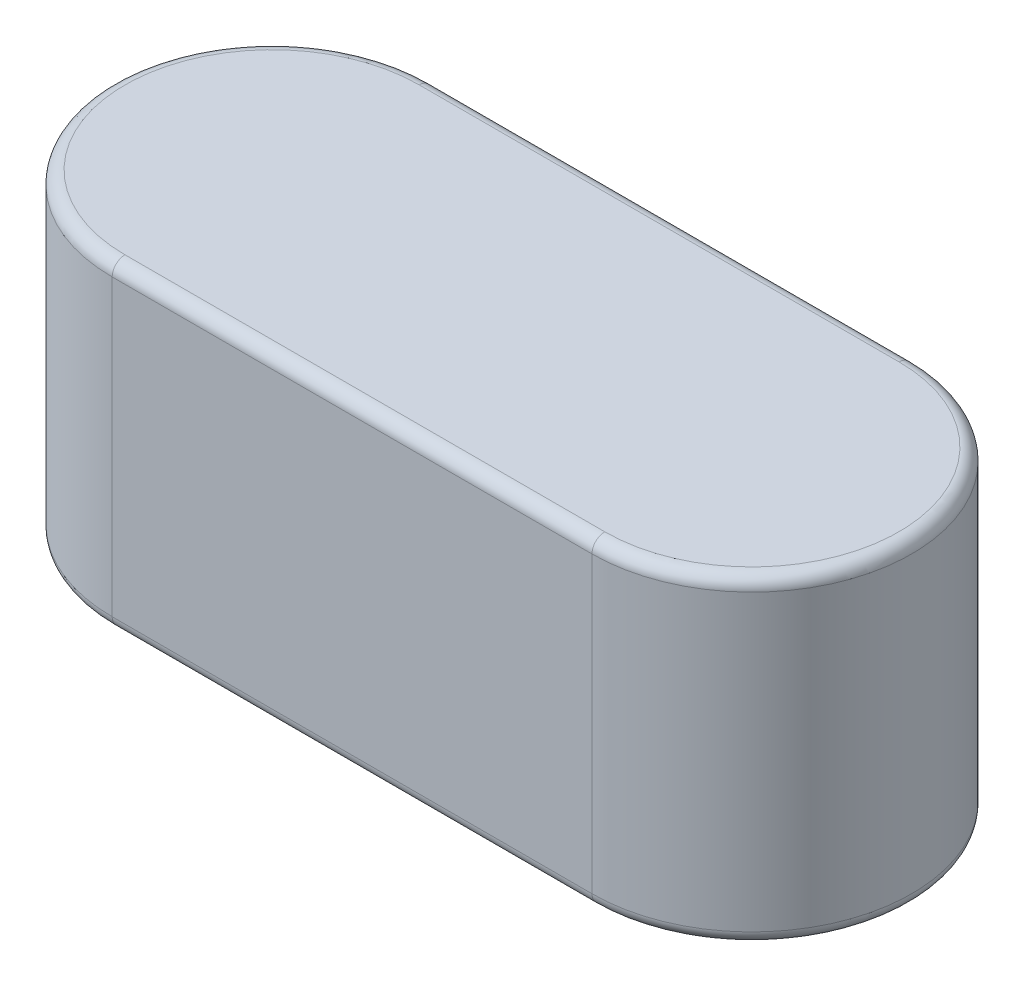
from build123d import *

# Parameters (mm, degrees)
EXTRUDE1_DEPTH = 4
FILLET1_R      = 0.16


with BuildPart() as part:
    # Sketch1 → Extrude1 (new body)
    with BuildSketch(Plane(origin=(0, 0, 0), x_dir=(1, 0, 0), z_dir=(0, 1, 0))):
        with BuildLine():
            Line((-6, 2), (0, 2))
            ThreePointArc((0, 2), (2, 0), (0, -2))
            Line((0, -2), (-6, -2))
            ThreePointArc((-6, -2), (-8, 0), (-6, 2))
        make_face()
    extrude(amount=EXTRUDE1_DEPTH)

    # Fillet1
    fillet1_edges = [part.edges().sort_by_distance(p)[0] for p in [
        (-3, 0, -2),
        (2, 0, 0),
        (-8, 0, 0),
        (-3, 0, 2),
        (2, 4, 0),
        (-3, 4, 2),
        (-3, 4, -2),
        (-8, 4, 0),
    ]]
    fillet(fillet1_edges, radius=FILLET1_R)


solid = part.part
